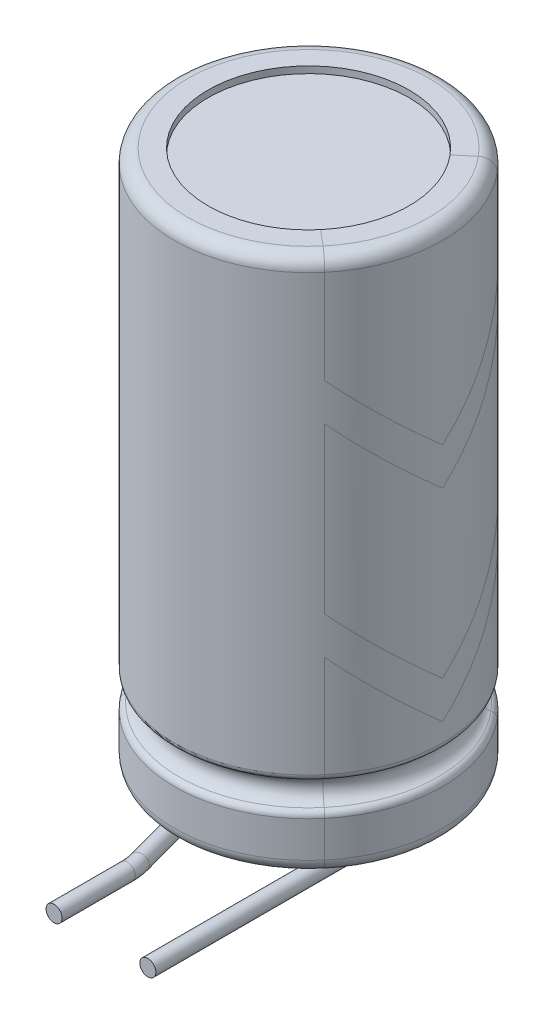
from build123d import *

# Parameters (mm, degrees)
SKETCH1_R          = 5
BASE_EXTRUDE_DEPTH = 20
SKETCH4_R          = 3.75
CUT_EXTRUDE1_DEPTH = 0.25
CUT_EXTRUDE3_START = -0.25
SKETCH6_R          = 3.75
CUT_EXTRUDE3_DEPTH = 0.25
FILLET3_R          = 0.5
FILLET4_R          = 0.25
SKETCH12_R         = 0.3
SKETCH17_R         = 0.3


with BuildPart() as part:
    # Sketch1 → Base-Extrude (new body)
    with BuildSketch(Plane(origin=(0, 0, 0), x_dir=(1, 0, 0), z_dir=(0, 1, 0))):
        Circle(SKETCH1_R)
    extrude(amount=BASE_EXTRUDE_DEPTH)

    # Sketch2 → Cut-Revolve1 (revolve, cut)
    with BuildSketch(Plane(origin=(0, 0, 0), x_dir=(0, 0, -1), z_dir=(1, 0, 0))):
        with BuildLine():
            Line((-5, 3.053185949), (-5, 2.053185949))
            ThreePointArc((-5, 2.053185949), (-4.5, 2.553185949), (-5, 3.053185949))
        make_face()
    revolve(axis=Axis((0, 0, 0), (0, 1, 0)), mode=Mode.SUBTRACT)

    # Sketch4 → Cut-Extrude1 (cut)
    with BuildSketch(Plane.XZ):
        Circle(SKETCH4_R)
    extrude(amount=-CUT_EXTRUDE1_DEPTH, mode=Mode.SUBTRACT)

    # Sketch6 → Cut-Extrude3 (cut)
    with BuildSketch(Plane(origin=(0, 20, 0), x_dir=(-1, 0, 0), z_dir=(0, 1, 0)).offset(CUT_EXTRUDE3_START)):
        Circle(SKETCH6_R)
    extrude(amount=CUT_EXTRUDE3_DEPTH, mode=Mode.SUBTRACT)

    # Fillet3
    fillet3_edges = [part.edges().sort_by_distance(p)[0] for p in [
        (-5, 20, 0),
        (-5, 0, 0),
        (-5, 0, 0),
        (-5, 0, 0),
        (-5, 0, 0),
        (-5, 20, 0),
    ]]
    fillet(fillet3_edges, radius=FILLET3_R)

    # Fillet4
    fillet4_edges = [part.edges().sort_by_distance(p)[0] for p in [
        (-3.535533906, 2.053185949, -3.535533906),
        (-3.535533906, 2.053185949, -3.535533906),
        (-3.535533906, 2.053185949, -3.535533906),
        (-3.535533906, 2.053185949, -3.535533906),
        (-3.535533906, 3.053185949, -3.535533906),
        (-3.535533906, 3.053185949, -3.535533906),
    ]]
    fillet(fillet4_edges, radius=FILLET4_R)

    # Sweep1: sweep along a path in Sketch14
    with BuildLine(Plane(origin=(0, 0, 0), x_dir=(0, 0, -1), z_dir=(1, 0, 0))) as sweep1_path:
        Line((0, 0.25), (0, -0.5))
        ThreePointArc((0, -0.5), (-0.146446609, -0.853553391), (-0.5, -1))
        Line((-0.5, -1), (-8.5, -1))
    # Sketch12 → Sweep1 (sweep)
    with BuildSketch(Plane(origin=(0, 0.25, 0), x_dir=(-1, 0, 0), z_dir=(0, -1, 0))):
        with Locations((-2.5, 0)):
            Circle(SKETCH12_R)
    sweep(path=sweep1_path.line)

    # Sweep3: sweep along a curve in space
    with BuildLine() as sweep3_path:
        Line((-2.5, 0.25, 0), (-2.5, -0.5, 0))
        ThreePointArc((-2.5, -0.5, 0), (-2.461467348, -0.853553391, 0.14128639), (-2.368441297, -1, 0.482381911))
        Line((-2.368441297, -1, 0.482381911), (-1.070472358, -1, 5.241601356))
        ThreePointArc((-1.070472358, -1, 5.241601356), (-1.01769638, -1, 5.502369865), (-1, -1, 5.767836167))
        Line((-1, -1, 5.767836167), (-1, -1, 8.5))
    # Sketch17 → Sweep3 (sweep)
    with BuildSketch(Plane(origin=(0, 0.25, 0), x_dir=(-1, 0, 0), z_dir=(0, -1, 0))):
        with Locations((2.5, 0)):
            Circle(SKETCH17_R)
    sweep(path=sweep3_path.line)


solid = part.part
